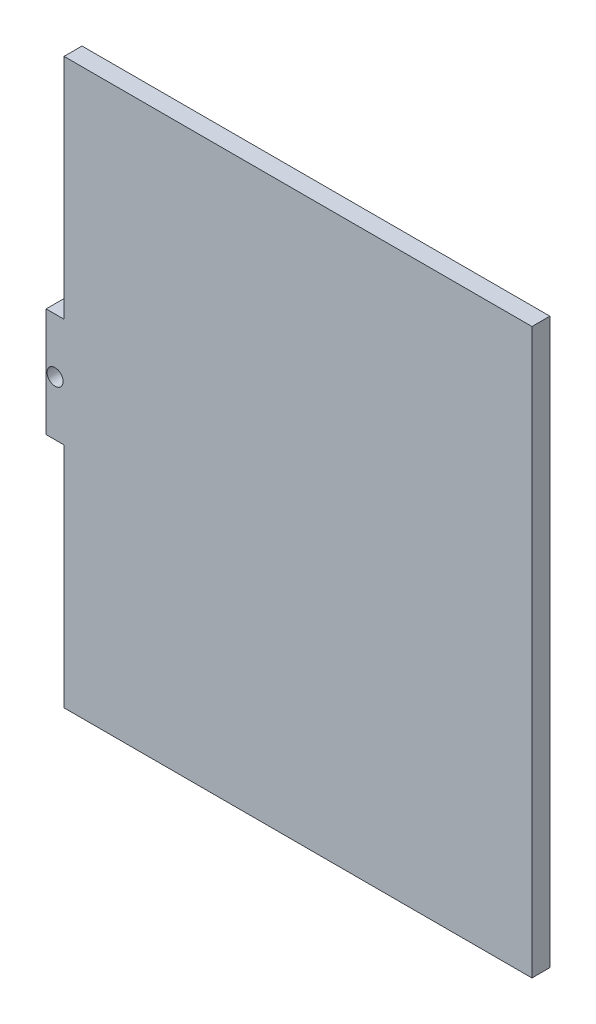
from build123d import *

# Parameters (mm, degrees)
BOSS_EXTRUDE1_DEPTH = 3.18
SKETCH9_W           = 3.18
SKETCH9_H           = 19.3
BOSS_EXTRUDE4_DEPTH = 3.18
SKETCH10_R          = 1.425
CUT_EXTRUDE4_DEPTH  = 68.106545322


with BuildPart() as part:
    # Sketch1 → Boss-Extrude1 (new body)
    with BuildSketch(Plane.XY):
        Polygon((-41.465, 50), (-13.821666667, 50), (13.821666667, 50), (41.465, 50), (41.465, -50), (-41.465, -50), align=None)
    extrude(amount=BOSS_EXTRUDE1_DEPTH)

    # Sketch9 → Boss-Extrude4 (add)
    with BuildSketch(Plane.ZY.offset(41.465)):
        with Locations((1.59, 0)):
            Rectangle(SKETCH9_W, SKETCH9_H)
    extrude(amount=BOSS_EXTRUDE4_DEPTH)

    # Sketch10 → Cut-Extrude4 (cut, through all)
    with BuildSketch(Plane.XY.offset(3.18)):
        with Locations((-43.055, 0)):
            Circle(SKETCH10_R)
    extrude(amount=-CUT_EXTRUDE4_DEPTH, mode=Mode.SUBTRACT)


solid = part.part
